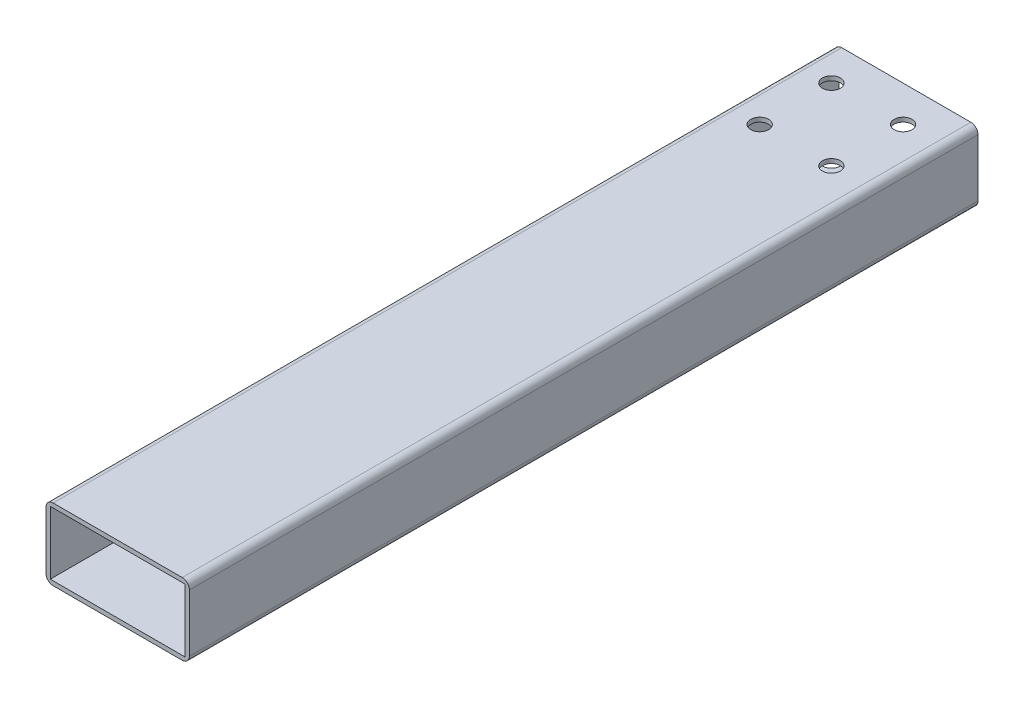
from build123d import *

# Parameters (mm, degrees)
SKETCH1_W           = 50.8
SKETCH1_H           = 25.4
SKETCH1_W_2         = 47.752
SKETCH1_H_2         = 22.352
BOSS_EXTRUDE1_DEPTH = 279.4
FILLET1_R           = 2.54
SKETCH2_R           = 3.175
CUT_EXTRUDE1_DEPTH  = 282.804743156


with BuildPart() as part:
    # Sketch1 → Boss-Extrude1 (new body)
    with BuildSketch(Plane.XY):
        with Locations((1.140408163, -1.275183673)):
            Rectangle(SKETCH1_W, SKETCH1_H)
        with Locations((1.140408163, -1.275183673)):
            Rectangle(SKETCH1_W_2, SKETCH1_H_2, mode=Mode.SUBTRACT)
    extrude(amount=BOSS_EXTRUDE1_DEPTH)

    # Fillet1
    fillet1_edges = [part.edges().sort_by_distance(p)[0] for p in [
        (26.540408163, -13.975183673, 139.7),
        (-24.259591837, -13.975183673, 139.7),
        (-24.259591837, 11.424816327, 139.7),
        (26.540408163, 11.424816327, 139.7),
    ]]
    fillet(fillet1_edges, radius=FILLET1_R)

    # Sketch2 → Cut-Extrude1 (cut, through all)
    with BuildSketch(Plane(origin=(0, 11.424816327, 0), x_dir=(1, 0, 0), z_dir=(0, 1, 0))):
        with Locations((-12.7, -12.7)):
            Circle(SKETCH2_R)
        with Locations((12.7, -12.7)):
            Circle(SKETCH2_R)
        with Locations((-12.7, -38.1)):
            Circle(SKETCH2_R)
        with Locations((12.7, -38.1)):
            Circle(SKETCH2_R)
    extrude(amount=-CUT_EXTRUDE1_DEPTH, mode=Mode.SUBTRACT)


solid = part.part
